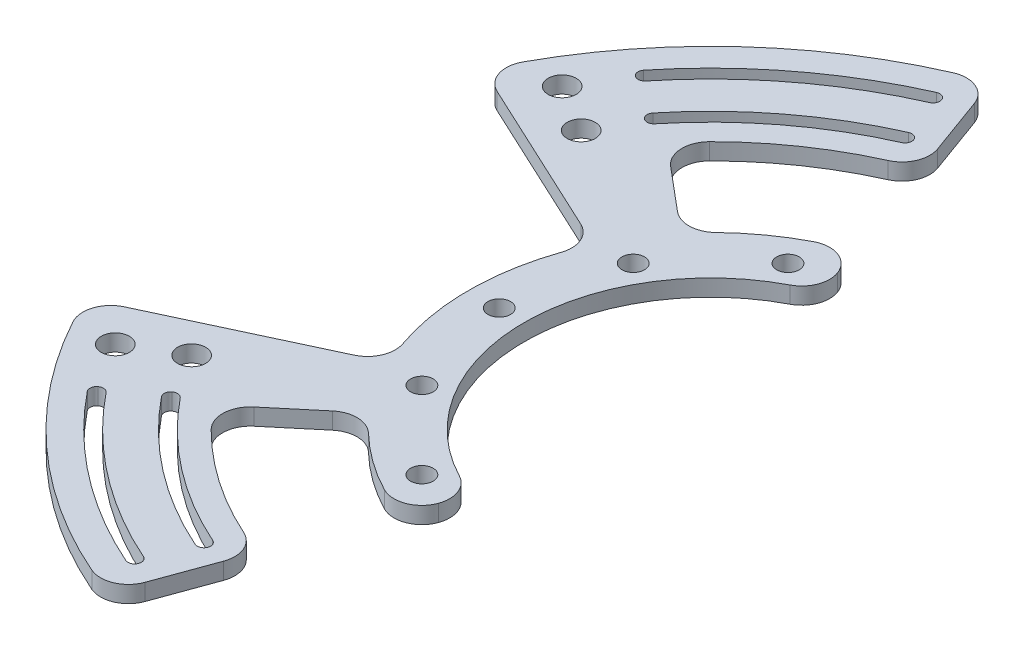
from build123d import *

# Parameters (mm, degrees)
SKETCH1_R               = 43.5
SKETCH1_R_2             = 33.5
BOSS_EXTRUDE1_DEPTH     = 3
SKETCH3_R               = 2.025
CUT_EXTRUDE2_DEPTH      = 62.591395503
CIRPATTERN1_COUNT       = 12
CUT_EXTRUDE1_DEPTH      = 62.591395503
BOSS_EXTRUDE2_DEPTH     = 3
CUT_EXTRUDE_THIN1_DEPTH = 3
FILLET1_R               = 1.2
FILLET2_R               = 5
SKETCH6_R               = 2.525
CUT_EXTRUDE3_DEPTH      = 108.998410492
MIRROR4_OUTLINE_R       = 2.525
MIRROR4_DEPTH           = 3


# Read off the part's stored shape, not the designer's step: Mirror4
with BuildPart() as part:
    # Sketch1 → Boss-Extrude1 (new body)
    with BuildSketch(Plane(origin=(0, 0, 0), x_dir=(1, 0, 0), z_dir=(0, 1, 0))):
        with Locations(Location((0, 0, 0), (0, 0, 270))):
            Circle(SKETCH1_R)
        with Locations(Location((0, 0, 0), (0, 0, 270))):
            Circle(SKETCH1_R_2, mode=Mode.SUBTRACT)
    extrude(amount=BOSS_EXTRUDE1_DEPTH)

    # Sketch3 → Cut-Extrude2 (cut, symmetric)
    with BuildSketch(Plane(origin=(0, 3, 0), x_dir=(1, 0, 0), z_dir=(0, 1, 0))):
        with Locations(Location((-38, 0, 0), (0, 0, 270))):
            Circle(SKETCH3_R)
    cut_extrude2 = extrude(amount=CUT_EXTRUDE2_DEPTH, both=True, mode=Mode.SUBTRACT)

    # CirPattern1: Cut-Extrude2 ×12 about axis
    cirpattern1_axis = Axis((0, 0, 0), (0, 1, 0))
    for i in range(1, CIRPATTERN1_COUNT):
        add(cut_extrude2.rotate(cirpattern1_axis, i * 360 / CIRPATTERN1_COUNT), mode=Mode.SUBTRACT)

    # Sketch2 → Cut-Extrude1 (cut, symmetric)
    with BuildSketch(Plane(origin=(0, 3, 0), x_dir=(1, 0, 0), z_dir=(0, 1, 0))):
        with BuildLine():
            Line((0, 0), (43.5, 0))
            ThreePointArc((43.5, 0), (24.950574981, -35.633113927), (-14.877876235, -40.876629004))
            Line((-14.877876235, -40.876629004), (0, 0))
        make_face()
    cut_extrude1 = extrude(amount=CUT_EXTRUDE1_DEPTH, both=True, mode=Mode.SUBTRACT)

    # Mirror1: Cut-Extrude1 across plane
    add(cut_extrude1.mirror(Plane.XY), mode=Mode.SUBTRACT)

    # Sketch4 → Boss-Extrude2 (add)
    with BuildSketch(Plane(origin=(0, 0, 0), x_dir=(1, 0, 0), z_dir=(0, 1, 0))):
        with BuildLine():
            ThreePointArc((-33.322933276, -27.961261021), (-36.687527893, -23.372532963), (-39.424388736, -18.383894386))
            Line((-39.424388736, -18.383894386), (-57.550544477, -26.836259621))
            Line((-57.550544477, -26.836259621), (-76.583008005, -35.711243117))
            ThreePointArc((-76.583008005, -35.711243117), (-57.087372544, -62.29993496), (-28.900702111, -79.404026456))
            Line((-28.900702111, -79.404026456), (-21.718279101, -59.67048142))
            ThreePointArc((-21.718279101, -59.67048142), (-36.422103708, -52.016154812), (-48.643822138, -40.817013215))
            Line((-48.643822138, -40.817013215), (-33.322933276, -27.961261021))
        make_face()
    extrude(amount=BOSS_EXTRUDE2_DEPTH)

    # Sketch5 → Cut-Extrude-Thin1 (cut)
    with BuildSketch(Plane(origin=(0, 3, 0), x_dir=(1, 0, 0), z_dir=(0, 1, 0))):
        with BuildLine():
            ThreePointArc((-55.318354903, -43.219435568), (-42.735052316, -55.693404488), (-27.42932522, -64.619440712))
            Line((-27.42932522, -64.619440712), (-26.491570512, -62.410229064))
            ThreePointArc((-26.491570512, -62.410229064), (-41.274024887, -53.789356472), (-53.427129095, -41.741848027))
            Line((-53.427129095, -41.741848027), (-55.318354903, -43.219435568))
        make_face()
        with BuildLine():
            ThreePointArc((-62.804457062, -49.068219583), (-48.518285892, -63.230261221), (-31.141270941, -73.36423682))
            Line((-31.141270941, -73.36423682), (-30.203516232, -71.155025172))
            ThreePointArc((-30.203516232, -71.155025172), (-47.057258462, -61.326213205), (-60.913231254, -47.590632043))
            Line((-60.913231254, -47.590632043), (-62.804457062, -49.068219583))
        make_face()
    extrude(amount=-CUT_EXTRUDE_THIN1_DEPTH, mode=Mode.SUBTRACT)

    # Fillet1
    fillet1_edges = [part.edges().sort_by_distance(p)[0] for p in [
        (-55.318354903, 1.5, 43.219435568),
        (-62.804457062, 1.5, 49.068219583),
        (-53.427129095, 1.5, 41.741848027),
        (-60.913231254, 1.5, 47.590632043),
        (-26.491570512, 1.5, 62.410229064),
        (-30.203516232, 1.5, 71.155025172),
        (-27.42932522, 1.5, 64.619440712),
        (-31.141270941, 1.5, 73.36423682),
    ]]
    fillet(fillet1_edges, radius=FILLET1_R - 0.0001)  # a hair under: the kernel refuses the full size

    # Fillet2
    fillet2_edges = [part.edges().sort_by_distance(p)[0] for p in [
        (-14.877876235, 1.5, -40.876629004),
        (-11.457674801, 1.5, -31.479702796),
        (-11.457674801, 1.5, 31.479702796),
        (-14.877876235, 1.5, 40.876629004),
        (-39.424388736, 1.5, 18.383894386),
        (-76.583008005, 1.5, 35.711243117),
        (-28.900702111, 1.5, 79.404026456),
        (-21.718279101, 1.5, 59.67048142),
        (-33.322933276, 1.5, 27.961261021),
        (-48.643822138, 1.5, 40.817013215),
    ]]
    fillet(fillet2_edges, radius=FILLET2_R - 0.0001)  # a hair under: the kernel refuses the full size

    # Sketch6 → Cut-Extrude3 (cut, symmetric)
    with BuildSketch(Plane(origin=(0, 3, 0), x_dir=(1, 0, 0), z_dir=(0, 1, 0))):
        with Locations(Location((-58.287376448, -35.022589094, 0), (0, 0, 270))):
            Circle(SKETCH6_R)
        with Locations(Location((-66.859049455, -40.172969843, 0), (0, 0, 270))):
            Circle(SKETCH6_R)
    extrude(amount=CUT_EXTRUDE3_DEPTH, both=True, mode=Mode.SUBTRACT)

    # Mirror4 outline → Mirror4 (add)
    with BuildSketch(Plane(origin=(0, 0, 0), x_dir=(1, 0, 0), z_dir=(0, 1, 0))):
        with BuildLine():
            ThreePointArc((-33.837450466, 77.42917374), (-57.087372544, 62.29993496), (-74.185404229, 40.457085898))
            ThreePointArc((-74.185404229, 40.457085898), (-74.545675834, 36.50174496), (-71.908826648, 33.531636555))
            Line((-71.908826648, 33.531636555), (-43.721719229, 20.387772504))
            ThreePointArc((-43.721719229, 20.387772504), (-41.230877439, 17.806566879), (-41.109572338, 14.221570314))
            ThreePointArc((-41.109572338, 14.221570314), (-36.687527893, 23.372532963), (-30.262775922, 31.247630206))
            ThreePointArc((-30.262775922, 31.247630206), (-33.563151977, 29.842484947), (-36.955193962, 31.009089623))
            Line((-36.955193962, 31.009089623), (-44.649615181, 37.46547563))
            ThreePointArc((-44.649615181, 37.46547563), (-46.430731946, 41.073375084), (-44.977187998, 44.82524467))
            ThreePointArc((-44.977187998, 44.82524467), (-36.095854194, 52.243079063), (-26.015854641, 57.926033071))
            ThreePointArc((-26.015854641, 57.926033071), (-23.458659602, 60.540951414), (-23.365884028, 64.197238753))
            Line((-23.365884028, 64.197238753), (-27.136771358, 74.557666543))
            ThreePointArc((-27.136771358, 74.557666543), (-29.865761055, 77.443343725), (-33.837450466, 77.42917374))
        make_face()
        with Locations((-66.859049455, 40.172969843)):
            Circle(MIRROR4_OUTLINE_R, mode=Mode.SUBTRACT)
        with Locations((-58.287376448, 35.022589094)):
            Circle(MIRROR4_OUTLINE_R, mode=Mode.SUBTRACT)
        with BuildLine():
            ThreePointArc((-54.558346188, 44.174957399), (-42.735052316, 55.693404488), (-28.548993164, 64.132635914))
            ThreePointArc((-28.548993164, 64.132635914), (-27.6211406, 64.152839182), (-26.956370363, 63.505228894))
            ThreePointArc((-26.956370363, 63.505228894), (-26.944488545, 62.596515953), (-27.57295921, 61.940067165))
            ThreePointArc((-27.57295921, 61.940067165), (-41.274024887, 53.789356472), (-52.693103583, 42.664702445))
            ThreePointArc((-52.693103583, 42.664702445), (-53.489844598, 42.227547847), (-54.364518656, 42.474217018))
            ThreePointArc((-54.364518656, 42.474217018), (-54.818006961, 43.283949635), (-54.558346188, 44.174957399))
        make_face(mode=Mode.SUBTRACT)
        with BuildLine():
            ThreePointArc((-62.0470311, 50.02255423), (-48.518285891, 63.230261221), (-32.259123686, 72.879619504))
            ThreePointArc((-32.259123686, 72.879619504), (-31.332405, 72.898334407), (-30.668809601, 72.251187656))
            ThreePointArc((-30.668809601, 72.251187656), (-30.657391319, 71.341299876), (-31.287707164, 70.685001099))
            ThreePointArc((-31.287707164, 70.685001099), (-47.057258463, 61.326213205), (-60.178613602, 48.516228883))
            ThreePointArc((-60.178613602, 48.516228883), (-60.975687285, 48.077253152), (-61.851616121, 48.323778652))
            ThreePointArc((-61.851616121, 48.323778652), (-62.304960755, 49.13225649), (-62.0470311, 50.02255423))
        make_face(mode=Mode.SUBTRACT)
    extrude(amount=MIRROR4_DEPTH)


solid = part.part
